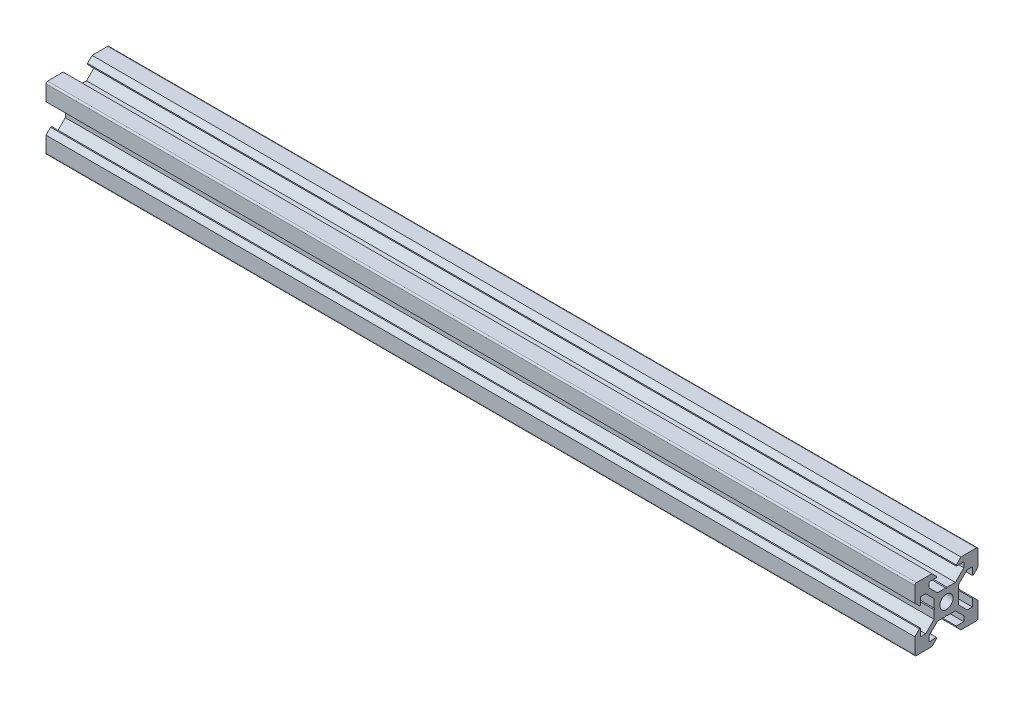
from build123d import *

# Parameters (mm, degrees)
PROFILE_SKETCH_R      = 2.1
PROFILE_EXTRUDE_DEPTH = 275


with BuildPart() as part:
    # Profile Sketch → Profile Extrude (new body)
    with BuildSketch(Plane(origin=(0, 0, 0), x_dir=(0, 0, -1), z_dir=(1, 0, 0))):
        with BuildLine():
            ThreePointArc((0, 9.5), (-0.146446609, 9.853553391), (-0.5, 10))
            Line((-0.5, 10), (-5.42, 10))
            Line((-5.42, 10), (-6.875, 8.545))
            Line((-6.875, 8.545), (-6.875, 8.2))
            Line((-6.875, 8.2), (-4.5, 8.2))
            Line((-4.5, 8.2), (-4.5, 6.56))
            Line((-4.5, 6.56), (-7.16, 3.9))
            Line((-7.16, 3.9), (-9.79, 3.9))
            Line((-9.79, 3.9), (-10, 3.69))
            Line((-10, 3.69), (-10.21, 3.9))
            Line((-10.21, 3.9), (-12.84, 3.9))
            Line((-12.84, 3.9), (-15.5, 6.56))
            Line((-15.5, 6.56), (-15.5, 8.2))
            Line((-15.5, 8.2), (-13.125, 8.2))
            Line((-13.125, 8.2), (-13.125, 8.545))
            Line((-13.125, 8.545), (-14.58, 10))
            Line((-14.58, 10), (-19.5, 10))
            ThreePointArc((-19.5, 10), (-19.853553391, 9.853553391), (-20, 9.5))
            Line((-20, 9.5), (-20, 4.58))
            Line((-20, 4.58), (-18.545, 3.125))
            Line((-18.545, 3.125), (-18.2, 3.125))
            Line((-18.2, 3.125), (-18.2, 5.5))
            Line((-18.2, 5.5), (-16.56, 5.5))
            Line((-16.56, 5.5), (-13.9, 2.838679656))
            Line((-13.9, 2.838679656), (-13.9, 0.21))
            Line((-13.9, 0.21), (-13.69, 0))
            Line((-13.69, 0), (-13.9, -0.21))
            Line((-13.9, -0.21), (-13.9, -2.838679656))
            Line((-13.9, -2.838679656), (-16.56, -5.5))
            Line((-16.56, -5.5), (-18.2, -5.5))
            Line((-18.2, -5.5), (-18.2, -3.125))
            Line((-18.2, -3.125), (-18.545, -3.125))
            Line((-18.545, -3.125), (-20, -4.58))
            Line((-20, -4.58), (-20, -9.5))
            ThreePointArc((-20, -9.5), (-19.853553391, -9.853553391), (-19.5, -10))
            Line((-19.5, -10), (-14.58, -10))
            Line((-14.58, -10), (-13.125, -8.545))
            Line((-13.125, -8.545), (-13.125, -8.2))
            Line((-13.125, -8.2), (-15.5, -8.2))
            Line((-15.5, -8.2), (-15.5, -6.56))
            Line((-15.5, -6.56), (-12.84, -3.9))
            Line((-12.84, -3.9), (-10.21, -3.9))
            Line((-10.21, -3.9), (-10, -3.69))
            Line((-10, -3.69), (-9.79, -3.9))
            Line((-9.79, -3.9), (-7.16, -3.9))
            Line((-7.16, -3.9), (-4.5, -6.56))
            Line((-4.5, -6.56), (-4.5, -8.2))
            Line((-4.5, -8.2), (-6.875, -8.2))
            Line((-6.875, -8.2), (-6.875, -8.545))
            Line((-6.875, -8.545), (-5.42, -10))
            Line((-5.42, -10), (-0.5, -10))
            ThreePointArc((-0.5, -10), (-0.146446609, -9.853553391), (0, -9.5))
            Line((0, -9.5), (0, -4.58))
            Line((0, -4.58), (-1.455, -3.125))
            Line((-1.455, -3.125), (-1.8, -3.125))
            Line((-1.8, -3.125), (-1.8, -5.5))
            Line((-1.8, -5.5), (-3.44, -5.5))
            Line((-3.44, -5.5), (-6.1, -2.838679656))
            Line((-6.1, -2.838679656), (-6.1, -0.21))
            Line((-6.1, -0.21), (-6.1, 2.838679656))
            Line((-6.1, 2.838679656), (-3.438679656, 5.5))
            Line((-3.438679656, 5.5), (-1.8, 5.5))
            Line((-1.8, 5.5), (-1.8, 3.125))
            Line((-1.8, 3.125), (-1.455, 3.125))
            Line((-1.455, 3.125), (0, 4.58))
            Line((0, 4.58), (0, 9.5))
        make_face()
        with Locations((-10, 0)):
            Circle(PROFILE_SKETCH_R, mode=Mode.SUBTRACT)
    extrude(amount=PROFILE_EXTRUDE_DEPTH)


solid = part.part
